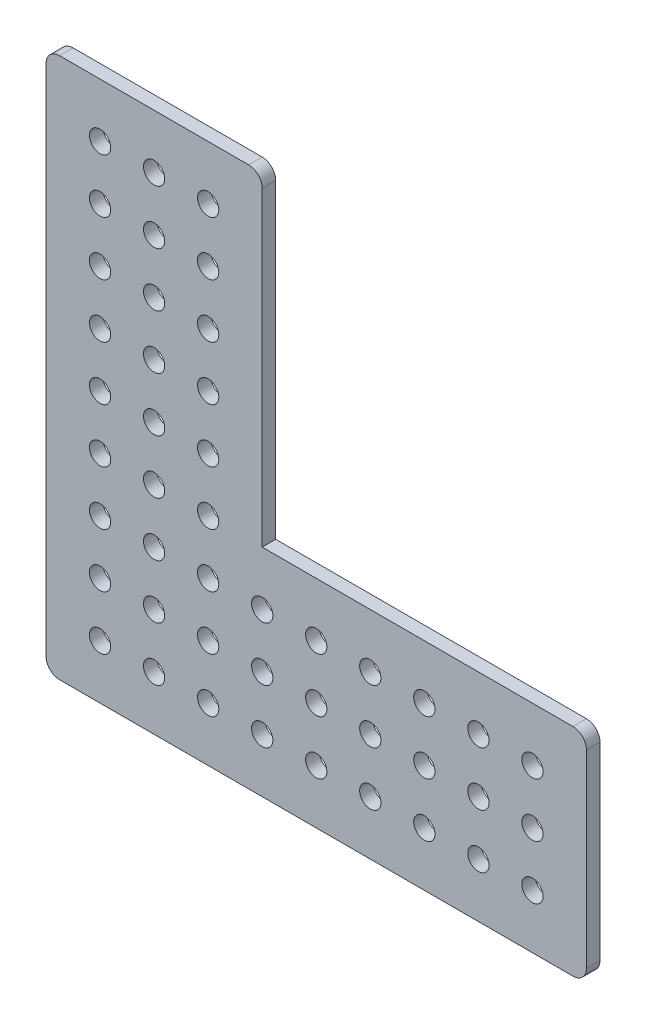
from build123d import *

# Parameters (mm, degrees)
BOSS_EXTRUDE1_DEPTH = 3.175
SKETCH2_R           = 2.5
CUT_EXTRUDE1_DEPTH  = 138.028584284


with BuildPart() as part:
    # Sketch1 → Boss-Extrude1 (new body)
    with BuildSketch(Plane.XY):
        with BuildLine():
            Line((-24.465030675, 87.672852761), (-24.465030675, -32.977147239))
            ThreePointArc((-24.465030675, -32.977147239), (-23.535094705, -35.22221127), (-21.290030675, -36.152147239))
            Line((-21.290030675, -36.152147239), (99.359969325, -36.152147239))
            ThreePointArc((99.359969325, -36.152147239), (101.605033355, -35.22221127), (102.534969325, -32.977147239))
            Line((102.534969325, -32.977147239), (102.534969325, 11.472852761))
            ThreePointArc((102.534969325, 11.472852761), (101.605033355, 13.717916791), (99.359969325, 14.647852761))
            Line((99.359969325, 14.647852761), (26.334969325, 14.647852761))
            Line((26.334969325, 14.647852761), (26.334969325, 87.672852761))
            ThreePointArc((26.334969325, 87.672852761), (25.405033355, 89.917916791), (23.159969325, 90.847852761))
            Line((23.159969325, 90.847852761), (-21.290030675, 90.847852761))
            ThreePointArc((-21.290030675, 90.847852761), (-23.535094705, 89.917916791), (-24.465030675, 87.672852761))
        make_face()
    extrude(amount=BOSS_EXTRUDE1_DEPTH)

    # Sketch2 → Cut-Extrude1 (cut, through all)
    with BuildSketch(Plane.XY.offset(3.175)):
        with Locations((-11.765030675, 78.147852761)):
            Circle(SKETCH2_R)
        with Locations((89.834969325, -23.452147239)):
            Circle(SKETCH2_R)
        with Locations((0.934969325, 78.147852761)):
            Circle(SKETCH2_R)
        with Locations((13.634969325, 78.147852761)):
            Circle(SKETCH2_R)
        with Locations((0.934969325, 65.447852761)):
            Circle(SKETCH2_R)
        with Locations((13.634969325, 65.447852761)):
            Circle(SKETCH2_R)
        with Locations((0.934969325, 52.747852761)):
            Circle(SKETCH2_R)
        with Locations((13.634969325, 52.747852761)):
            Circle(SKETCH2_R)
        with Locations((0.934969325, 40.047852761)):
            Circle(SKETCH2_R)
        with Locations((13.634969325, 40.047852761)):
            Circle(SKETCH2_R)
        with Locations((0.934969325, 27.347852761)):
            Circle(SKETCH2_R)
        with Locations((13.634969325, 27.347852761)):
            Circle(SKETCH2_R)
        with Locations((0.934969325, 14.647852761)):
            Circle(SKETCH2_R)
        with Locations((13.634969325, 14.647852761)):
            Circle(SKETCH2_R)
        with Locations((0.934969325, 1.947852761)):
            Circle(SKETCH2_R)
        with Locations((13.634969325, 1.947852761)):
            Circle(SKETCH2_R)
        with Locations((0.934969325, -10.752147239)):
            Circle(SKETCH2_R)
        with Locations((13.634969325, -10.752147239)):
            Circle(SKETCH2_R)
        with Locations((0.934969325, -23.452147239)):
            Circle(SKETCH2_R)
        with Locations((13.634969325, -23.452147239)):
            Circle(SKETCH2_R)
        with Locations((-11.765030675, 65.447852761)):
            Circle(SKETCH2_R)
        with Locations((-11.765030675, 52.747852761)):
            Circle(SKETCH2_R)
        with Locations((-11.765030675, 40.047852761)):
            Circle(SKETCH2_R)
        with Locations((-11.765030675, 27.347852761)):
            Circle(SKETCH2_R)
        with Locations((-11.765030675, 14.647852761)):
            Circle(SKETCH2_R)
        with Locations((-11.765030675, 1.947852761)):
            Circle(SKETCH2_R)
        with Locations((-11.765030675, -10.752147239)):
            Circle(SKETCH2_R)
        with Locations((-11.765030675, -23.452147239)):
            Circle(SKETCH2_R)
        with Locations((77.134969325, -23.452147239)):
            Circle(SKETCH2_R)
        with Locations((64.434969325, -23.452147239)):
            Circle(SKETCH2_R)
        with Locations((51.734969325, -23.452147239)):
            Circle(SKETCH2_R)
        with Locations((39.034969325, -23.452147239)):
            Circle(SKETCH2_R)
        with Locations((26.334969325, -23.452147239)):
            Circle(SKETCH2_R)
        with Locations((77.134969325, -10.752147239)):
            Circle(SKETCH2_R)
        with Locations((64.434969325, -10.752147239)):
            Circle(SKETCH2_R)
        with Locations((51.734969325, -10.752147239)):
            Circle(SKETCH2_R)
        with Locations((39.034969325, -10.752147239)):
            Circle(SKETCH2_R)
        with Locations((26.334969325, -10.752147239)):
            Circle(SKETCH2_R)
        with Locations((77.134969325, 1.947852761)):
            Circle(SKETCH2_R)
        with Locations((64.434969325, 1.947852761)):
            Circle(SKETCH2_R)
        with Locations((51.734969325, 1.947852761)):
            Circle(SKETCH2_R)
        with Locations((39.034969325, 1.947852761)):
            Circle(SKETCH2_R)
        with Locations((26.334969325, 1.947852761)):
            Circle(SKETCH2_R)
        with Locations((89.834969325, -10.752147239)):
            Circle(SKETCH2_R)
        with Locations((89.834969325, 1.947852761)):
            Circle(SKETCH2_R)
    extrude(amount=-CUT_EXTRUDE1_DEPTH, mode=Mode.SUBTRACT)


solid = part.part
